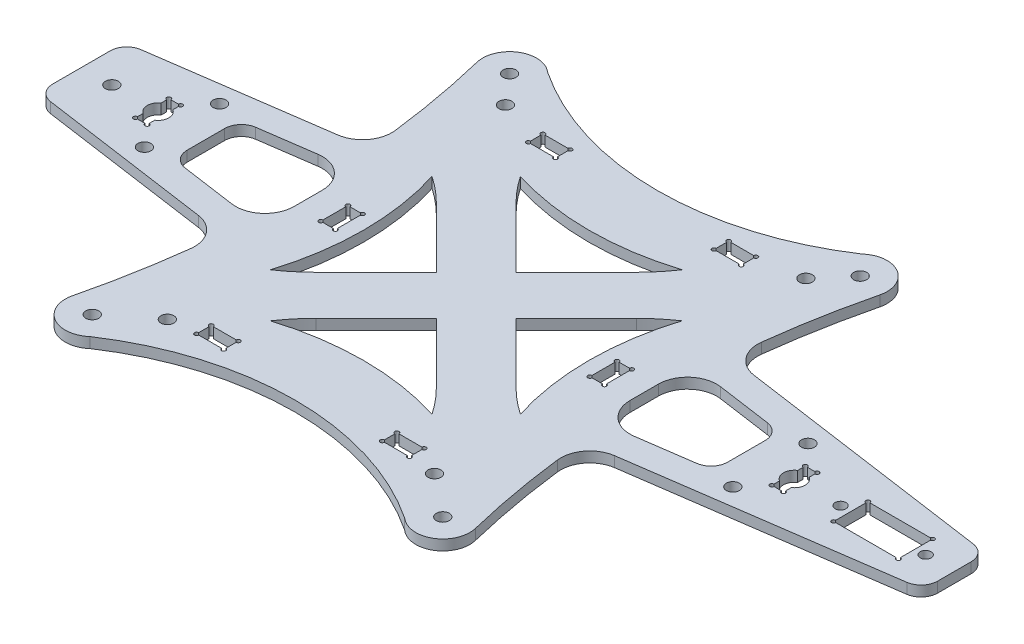
from build123d import *

# Parameters (mm, degrees)
SKETCH_1_R             = 1.55
SKETCH_1_R_2           = 1.3
SKETCH_1_W             = 6.5
SKETCH_1_H             = 3.5
SKETCH_1_W_2           = 3.5
SKETCH_1_H_2           = 6.5
SKETCH_1_W_3           = 15.5
SKETCH_1_H_3           = 8.2
EXTRUDE_1_DEPTH        = 2.5
FILLET_1_R             = 4
FILLET_2_R             = 7
SKETCH_2_R             = 0.5
CUT_EXTRUDE_4968_DEPTH = 128.770204339


with BuildPart() as part:
    # 草图1 → 凸台-拉伸1 (new body)
    with BuildSketch(Plane(origin=(0, 0, 0), x_dir=(1, 0, 0), z_dir=(0, 1, 0))):
        with BuildLine():
            Line((114.591143215, 7.468307572), (114.591143215, -7.468307572))
            Line((114.591143215, -7.468307572), (43.193640968, -17.646273029))
            ThreePointArc((43.193640968, -17.646273029), (45.143245402, -33.15226541), (48.27557779, -48.463217404))
            ThreePointArc((48.27557779, -48.463217404), (45.335063646, -55.533708325), (37.709796983, -54.831018053))
            ThreePointArc((37.709796983, -54.831018053), (0, -43.436211003), (-37.709796983, -54.831018053))
            ThreePointArc((-37.709796983, -54.831018053), (-45.335063646, -55.533708325), (-48.27557779, -48.463217404))
            ThreePointArc((-48.27557779, -48.463217404), (-45.143245402, -33.15226541), (-43.193640968, -17.646273029))
            Line((-43.193640968, -17.646273029), (-94.579518436, -10.321035179))
            Line((-94.579518436, -10.321035179), (-94.579518436, 10.321035179))
            Line((-94.579518436, 10.321035179), (-43.193640968, 17.646273029))
            ThreePointArc((-43.193640968, 17.646273029), (-45.143245402, 33.15226541), (-48.27557779, 48.463217404))
            ThreePointArc((-48.27557779, 48.463217404), (-45.335063646, 55.533708325), (-37.709796983, 54.831018053))
            ThreePointArc((-37.709796983, 54.831018053), (0, 43.436211003), (37.709796983, 54.831018053))
            ThreePointArc((37.709796983, 54.831018053), (45.335063646, 55.533708325), (48.27557779, 48.463217404))
            ThreePointArc((48.27557779, 48.463217404), (45.143245402, 33.15226541), (43.193640968, 17.646273029))
            Line((43.193640968, 17.646273029), (114.591143215, 7.468307572))
        make_face()
        with Locations((-36, 43)):
            Circle(SKETCH_1_R, mode=Mode.SUBTRACT)
        with Locations((-32, -42)):
            Circle(SKETCH_1_R, mode=Mode.SUBTRACT)
        with Locations((32, -42)):
            Circle(SKETCH_1_R, mode=Mode.SUBTRACT)
        with Locations((36, 43)):
            Circle(SKETCH_1_R, mode=Mode.SUBTRACT)
        with Locations((42, 50)):
            Circle(SKETCH_1_R, mode=Mode.SUBTRACT)
        with Locations((42, -50)):
            Circle(SKETCH_1_R, mode=Mode.SUBTRACT)
        with Locations((-42, -50)):
            Circle(SKETCH_1_R, mode=Mode.SUBTRACT)
        with Locations((-42, 50)):
            Circle(SKETCH_1_R, mode=Mode.SUBTRACT)
        with Locations((107.7, 0)):
            Circle(SKETCH_1_R_2, mode=Mode.SUBTRACT)
        with Locations((87.3, 0)):
            Circle(SKETCH_1_R_2, mode=Mode.SUBTRACT)
        with Locations((70.5, 9)):
            Circle(SKETCH_1_R, mode=Mode.SUBTRACT)
        with Locations((70.5, -9)):
            Circle(SKETCH_1_R, mode=Mode.SUBTRACT)
        with Locations((-70.5, -9)):
            Circle(SKETCH_1_R, mode=Mode.SUBTRACT)
        with Locations((-70.5, 9)):
            Circle(SKETCH_1_R, mode=Mode.SUBTRACT)
        with Locations((-87.3, 0)):
            Circle(SKETCH_1_R, mode=Mode.SUBTRACT)
        with Locations((-22.25, 39.75)):
            Rectangle(SKETCH_1_W, SKETCH_1_H, mode=Mode.SUBTRACT)
        with Locations((-32.25, 0)):
            Rectangle(SKETCH_1_W_2, SKETCH_1_H_2, mode=Mode.SUBTRACT)
        with Locations((-22.25, -39.75)):
            Rectangle(SKETCH_1_W, SKETCH_1_H, mode=Mode.SUBTRACT)
        with Locations((22.25, 39.75)):
            Rectangle(SKETCH_1_W, SKETCH_1_H, mode=Mode.SUBTRACT)
        with Locations((22.25, -39.75)):
            Rectangle(SKETCH_1_W, SKETCH_1_H, mode=Mode.SUBTRACT)
        with Locations((32.25, 0)):
            Rectangle(SKETCH_1_W_2, SKETCH_1_H_2, mode=Mode.SUBTRACT)
        with BuildLine():
            Line((77.65, -2.151778405), (77.65, -4))
            Line((77.65, -4), (74.85, -4))
            Line((74.85, -4), (74.85, -2.176778405))
            ThreePointArc((74.85, -2.176778405), (73.652957971, 0), (74.85, 2.176778405))
            Line((74.85, 2.176778405), (74.85, 4))
            Line((74.85, 4), (77.65, 4))
            Line((77.65, 4), (77.65, 2.151778405))
            ThreePointArc((77.65, 2.151778405), (78.8083942, 0), (77.65, -2.151778405))
        make_face(mode=Mode.SUBTRACT)
        with Locations((97.5, 0)):
            Rectangle(SKETCH_1_W_3, SKETCH_1_H_3, mode=Mode.SUBTRACT)
        with BuildLine():
            Line((-74.85, -2.176778405), (-74.85, -4))
            Line((-74.85, -4), (-77.65, -4))
            Line((-77.65, -4), (-77.65, -2.151778405))
            ThreePointArc((-77.65, -2.151778405), (-78.8083942, 0), (-77.65, 2.151778405))
            Line((-77.65, 2.151778405), (-77.65, 4))
            Line((-77.65, 4), (-74.85, 4))
            Line((-74.85, 4), (-74.85, 2.176778405))
            ThreePointArc((-74.85, 2.176778405), (-73.652957971, 0), (-74.85, -2.176778405))
        make_face(mode=Mode.SUBTRACT)
        with BuildLine():
            Line((-23.978041684, 14.429581723), (-9.54845996, 0))
            Line((-9.54845996, 0), (-23.978041684, -14.429581723))
            ThreePointArc((-23.978041684, -14.429581723), (-26.851664039, -17.042325553), (-29.960234119, -19.370614155))
            ThreePointArc((-29.960234119, -19.370614155), (-27.006361348, 0), (-29.960234119, 19.370614155))
            ThreePointArc((-29.960234119, 19.370614155), (-26.851664039, 17.042325553), (-23.978041684, 14.429581723))
        make_face(mode=Mode.SUBTRACT)
        with BuildLine():
            Line((14.429581723, 23.978041684), (0, 9.54845996))
            Line((0, 9.54845996), (-14.429581723, 23.978041684))
            ThreePointArc((-14.429581723, 23.978041684), (-17.042325553, 26.851664039), (-19.370614155, 29.960234119))
            ThreePointArc((-19.370614155, 29.960234119), (0, 27.006361348), (19.370614155, 29.960234119))
            ThreePointArc((19.370614155, 29.960234119), (17.042325553, 26.851664039), (14.429581723, 23.978041684))
        make_face(mode=Mode.SUBTRACT)
        with BuildLine():
            Line((23.978041684, -14.429581723), (9.54845996, 0))
            Line((9.54845996, 0), (23.978041684, 14.429581723))
            ThreePointArc((23.978041684, 14.429581723), (26.851664039, 17.042325553), (29.960234119, 19.370614155))
            ThreePointArc((29.960234119, 19.370614155), (27.006361348, 0), (29.960234119, -19.370614155))
            ThreePointArc((29.960234119, -19.370614155), (26.851664039, -17.042325553), (23.978041684, -14.429581723))
        make_face(mode=Mode.SUBTRACT)
        with BuildLine():
            Line((-14.429581723, -23.978041684), (0, -9.54845996))
            Line((0, -9.54845996), (14.429581723, -23.978041684))
            ThreePointArc((14.429581723, -23.978041684), (17.042325553, -26.851664039), (19.370614155, -29.960234119))
            ThreePointArc((19.370614155, -29.960234119), (0, -27.006361348), (-19.370614155, -29.960234119))
            ThreePointArc((-19.370614155, -29.960234119), (-17.042325553, -26.851664039), (-14.429581723, -23.978041684))
        make_face(mode=Mode.SUBTRACT)
        Polygon((-64.75, -7.957119899), (-64.75, 7.957119899), (-40.25, 11.449681205), (-40.25, -11.449681205), align=None, mode=Mode.SUBTRACT)
        Polygon((64.75, 7.957119899), (40.25, 11.449681205), (40.25, -11.449681205), (64.75, -7.957119899), align=None, mode=Mode.SUBTRACT)
    extrude(amount=EXTRUDE_1_DEPTH)

    # 圆角1
    fillet_1_edges = [part.edges().sort_by_distance(p)[0] for p in [
        (114.591143215, 1.25, -7.468307572),
        (114.591143215, 1.25, 7.468307572),
        (-94.579518436, 1.25, 10.321035179),
        (-94.579518436, 1.25, -10.321035179),
        (-64.75, 1.25, 7.957119899),
        (-64.75, 1.25, -7.957119899),
        (64.75, 1.25, 7.957119899),
        (64.75, 1.25, -7.957119899),
    ]]
    fillet(fillet_1_edges, radius=FILLET_1_R)

    # 圆角2
    fillet_2_edges = [part.edges().sort_by_distance(p)[0] for p in [
        (43.193640968, 1.25, -17.646273029),
        (43.193640968, 1.25, 17.646273029),
        (-43.193640968, 1.25, 17.646273029),
        (-43.193640968, 1.25, -17.646273029),
        (40.25, 1.25, 11.449681205),
        (40.25, 1.25, -11.449681205),
        (-40.25, 1.25, 11.449681205),
        (-40.25, 1.25, -11.449681205),
    ]]
    fillet(fillet_2_edges, radius=FILLET_2_R)

    # 草图2 → Cut-Extrude 4968 (cut, through all)
    with BuildSketch(Plane(origin=(0, 2.5, 0), x_dir=(1, 0, 0), z_dir=(0, 1, 0))):
        with Locations((-77.65, 4)):
            Circle(SKETCH_2_R)
        with Locations((-74.85, 4)):
            Circle(SKETCH_2_R)
        with Locations((-77.65, -4)):
            Circle(SKETCH_2_R)
        with Locations((-74.85, -4)):
            Circle(SKETCH_2_R)
        with Locations((-25.5, 41.5)):
            Circle(SKETCH_2_R)
        with Locations((-19, 41.5)):
            Circle(SKETCH_2_R)
        with Locations((-25.5, 38)):
            Circle(SKETCH_2_R)
        with Locations((-19, 38)):
            Circle(SKETCH_2_R)
        with Locations((-34, 3.25)):
            Circle(SKETCH_2_R)
        with Locations((-30.5, 3.25)):
            Circle(SKETCH_2_R)
        with Locations((-34, -3.25)):
            Circle(SKETCH_2_R)
        with Locations((-30.5, -3.25)):
            Circle(SKETCH_2_R)
        with Locations((-25.5, -38)):
            Circle(SKETCH_2_R)
        with Locations((-19, -38)):
            Circle(SKETCH_2_R)
        with Locations((-25.5, -41.5)):
            Circle(SKETCH_2_R)
        with Locations((-19, -41.5)):
            Circle(SKETCH_2_R)
        with Locations((19, -41.5)):
            Circle(SKETCH_2_R)
        with Locations((25.5, -41.5)):
            Circle(SKETCH_2_R)
        with Locations((19, -38)):
            Circle(SKETCH_2_R)
        with Locations((25.5, -38)):
            Circle(SKETCH_2_R)
        with Locations((30.5, -3.25)):
            Circle(SKETCH_2_R)
        with Locations((34, -3.25)):
            Circle(SKETCH_2_R)
        with Locations((30.5, 3.25)):
            Circle(SKETCH_2_R)
        with Locations((34, 3.25)):
            Circle(SKETCH_2_R)
        with Locations((19, 38)):
            Circle(SKETCH_2_R)
        with Locations((25.5, 38)):
            Circle(SKETCH_2_R)
        with Locations((19, 41.5)):
            Circle(SKETCH_2_R)
        with Locations((25.5, 41.5)):
            Circle(SKETCH_2_R)
        with Locations((74.85, -4)):
            Circle(SKETCH_2_R)
        with Locations((77.65, -4)):
            Circle(SKETCH_2_R)
        with Locations((74.85, 4)):
            Circle(SKETCH_2_R)
        with Locations((77.65, 4)):
            Circle(SKETCH_2_R)
        with Locations((89.75, 4.1)):
            Circle(SKETCH_2_R)
        with Locations((105.25, 4.1)):
            Circle(SKETCH_2_R)
        with Locations((89.75, -4.1)):
            Circle(SKETCH_2_R)
        with Locations((105.25, -4.1)):
            Circle(SKETCH_2_R)
    extrude(amount=-CUT_EXTRUDE_4968_DEPTH, mode=Mode.SUBTRACT)


solid = part.part
